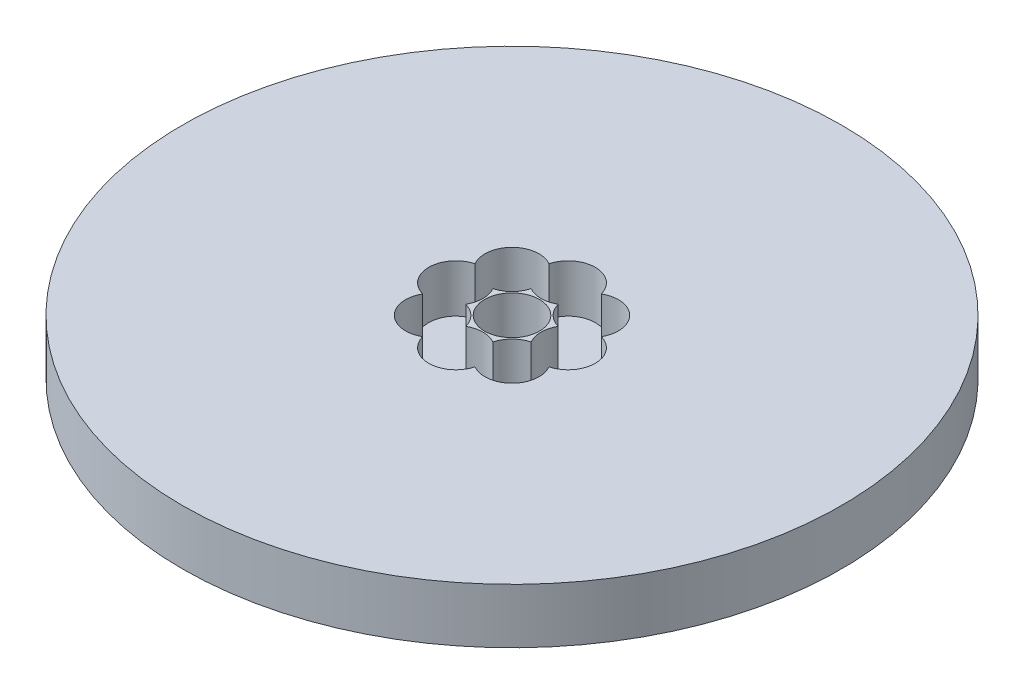
from build123d import *

# Parameters (mm, degrees)
SKETCH1_R           = 60
BOSS_EXTRUDE1_DEPTH = 10
SKETCH2_R           = 5
CUT_EXTRUDE1_DEPTH  = 86.440037453
SKETCH3_R           = 4.931187375
CUT_EXTRUDE2_DEPTH  = 8.729105942
CIRPATTERN1_COUNT   = 8


with BuildPart() as part:
    # Sketch1 → Boss-Extrude1 (new body)
    with BuildSketch(Plane(origin=(0, 0, 0), x_dir=(1, 0, 0), z_dir=(0, 1, 0))):
        Circle(SKETCH1_R)
    extrude(amount=BOSS_EXTRUDE1_DEPTH)

    # Sketch2 → Cut-Extrude1 (cut, through all)
    with BuildSketch(Plane(origin=(0, 0, 0), x_dir=(1, 0, 0), z_dir=(0, 1, 0))):
        Circle(SKETCH2_R)
    extrude(amount=CUT_EXTRUDE1_DEPTH, mode=Mode.SUBTRACT)

    # Sketch3 → Cut-Extrude2 (cut)
    with BuildSketch(Plane(origin=(0, 10, 0), x_dir=(1, 0, 0), z_dir=(0, 1, 0))):
        with Locations((-10.222069231, 0)):
            Circle(SKETCH3_R)
    cut_extrude2 = extrude(amount=-CUT_EXTRUDE2_DEPTH, mode=Mode.SUBTRACT)

    # CirPattern1: Cut-Extrude2 ×8 about axis
    cirpattern1_axis = Axis((0, 0, 0), (0, 1, 0))
    for i in range(1, CIRPATTERN1_COUNT):
        add(cut_extrude2.rotate(cirpattern1_axis, i * 360 / CIRPATTERN1_COUNT), mode=Mode.SUBTRACT)


solid = part.part
